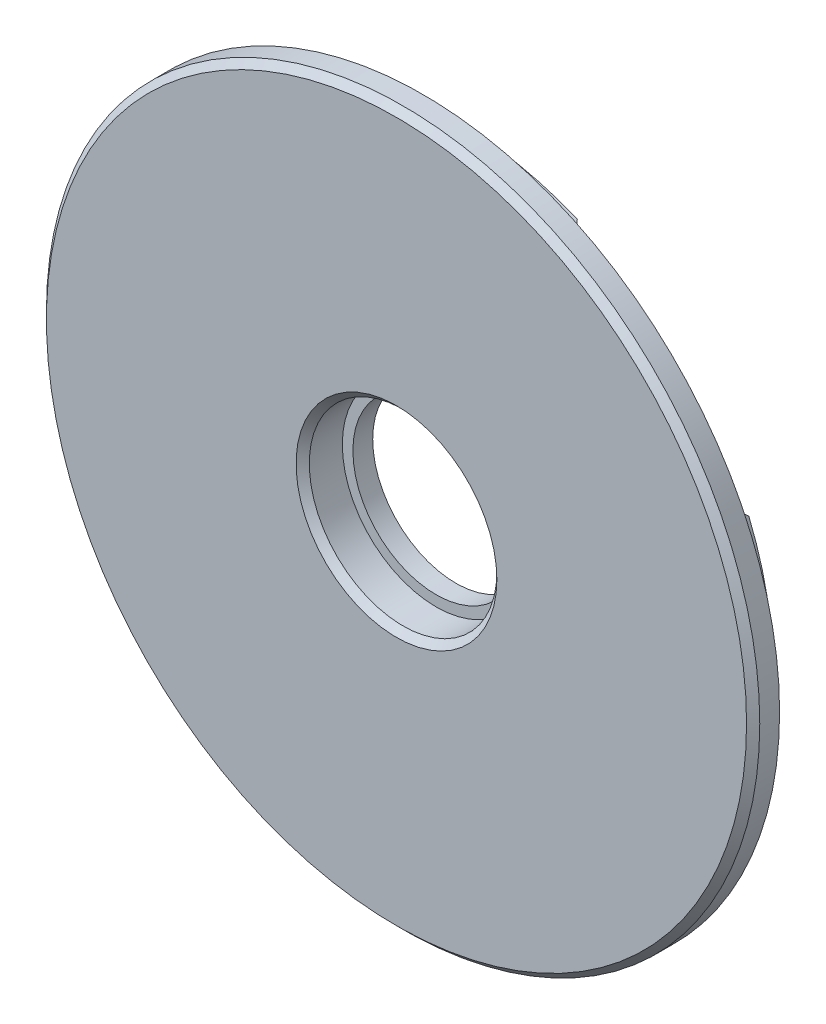
from build123d import *

# Parameters (mm, degrees)
SKETCH1_R                    = 24
SKETCH1_R_2                  = 22.8
BOSS_EXTRUDE1_DEPTH          = 2.5
BOSS_EXTRUDE5_START          = -2.5
BOSS_EXTRUDE5_DEPTH          = 1.5
CIRPATTERN1_COUNT            = 4
SKETCH2_R                    = 27
BOSS_EXTRUDE2_DEPTH          = 2
SKETCH3_R                    = 7.1
CUT_EXTRUDE1_DEPTH           = 39.448016854
SKETCH4_R                    = 8.3
SKETCH4_R_2                  = 7.1
BOSS_EXTRUDE3_DEPTH          = 2.5
BOSS_EXTRUDE4_START          = -1.5
SKETCH5_R                    = 8.3
SKETCH5_R_2                  = 6.3
BOSS_EXTRUDE4_DEPTH          = 1.5
CUT_EXTRUDE2_DEPTH           = 2.5
CHAMFER2_SIZE                = 2.5
CIRPATTERN2_COUNT            = 4
CHAMFER2_OF_CIRPATTERN2_SIZE = 2.5
FILLET1_R                    = 2
CHAMFER1_SIZE                = 0.5


# Some blends are built 0.0001 mm under size
with BuildPart() as part:
    # Sketch1 → Boss-Extrude1 (new body)
    with BuildSketch(Plane.XY):
        Circle(SKETCH1_R)
        Circle(SKETCH1_R_2, mode=Mode.SUBTRACT)
    extrude(amount=BOSS_EXTRUDE1_DEPTH)

    # Sketch6 → Boss-Extrude5 (add)
    with BuildSketch(Plane.XY.offset(2.5).offset(BOSS_EXTRUDE5_START)):
        with BuildLine():
            ThreePointArc((23.953079134, 1.5), (24, 0), (23.953079134, -1.5))
            ThreePointArc((23.953079134, -1.5), (24.3, 0), (23.953079134, 1.5))
        make_face()
    boss_extrude5 = extrude(amount=BOSS_EXTRUDE5_DEPTH)

    # CirPattern1: Boss-Extrude5 ×4 about axis
    cirpattern1_axis = Axis((0, 0, 0), (0, 0, 1))
    for i in range(1, CIRPATTERN1_COUNT):
        add(boss_extrude5.rotate(cirpattern1_axis, i * 360 / CIRPATTERN1_COUNT))

    # Sketch2 → Boss-Extrude2 (add)
    with BuildSketch(Plane.XY.offset(2.5)):
        Circle(SKETCH2_R)
    extrude(amount=BOSS_EXTRUDE2_DEPTH)

    # Sketch3 → Cut-Extrude1 (cut, through all)
    with BuildSketch(Plane.XY.offset(4.5)):
        Circle(SKETCH3_R)
    extrude(amount=-CUT_EXTRUDE1_DEPTH, mode=Mode.SUBTRACT)

    # Sketch4 → Boss-Extrude3 (add, through all)
    with BuildSketch(Plane(origin=(0, 0, 2.5), x_dir=(-1, 0, 0), z_dir=(0, 0, -1))):
        with Locations(Location((0, 0, 0), (0, 0, 180))):
            Circle(SKETCH4_R)
        with Locations(Location((0, 0, 0), (0, 0, 180))):
            Circle(SKETCH4_R_2, mode=Mode.SUBTRACT)
    extrude(amount=BOSS_EXTRUDE3_DEPTH)

    # Sketch5 → Boss-Extrude4 (add)
    with BuildSketch(Plane(origin=(0, 0, 0), x_dir=(-1, 0, 0), z_dir=(0, 0, -1)).offset(BOSS_EXTRUDE4_START)):
        with Locations(Location((0, 0, 0), (0, 0, 180))):
            Circle(SKETCH5_R)
        Circle(SKETCH5_R_2, mode=Mode.SUBTRACT)
    extrude(amount=BOSS_EXTRUDE4_DEPTH)

    # Sketch7 → Cut-Extrude2 (cut)
    with BuildSketch(Plane(origin=(0, 0, 0), x_dir=(-1, 0, 0), z_dir=(0, 0, -1))):
        with BuildLine():
            ThreePointArc((8.725182258, 21.064453341), (12.667001313, 18.95750716), (16.122034611, 16.122034611))
            Line((16.122034611, 16.122034611), (16.970562748, 16.970562748))
            ThreePointArc((16.970562748, 16.970562748), (13.333685592, 19.955270695), (9.184402377, 22.17310878))
            Line((9.184402377, 22.17310878), (8.725182258, 21.064453341))
        make_face()
        with BuildLine():
            Line((16.970562748, 16.970562748), (16.122034611, 16.122034611))
            ThreePointArc((16.122034611, 16.122034611), (18.95750716, 12.667001313), (21.064453341, 8.725182258))
            Line((21.064453341, 8.725182258), (22.17310878, 9.184402377))
            ThreePointArc((22.17310878, 9.184402377), (19.955270695, 13.333685592), (16.970562748, 16.970562748))
        make_face()
    cut_extrude2 = extrude(amount=-CUT_EXTRUDE2_DEPTH, mode=Mode.SUBTRACT)

    # Chamfer2
    chamfer2_edges = [part.edges().sort_by_distance(p)[0] for p in [
        (-21.618781061, 8.954792317, 2.5),
        (-8.954792317, 21.618781061, 2.5),
    ]]
    chamfer(chamfer2_edges, length=CHAMFER2_SIZE - 0.0001)  # a hair under: the kernel refuses the full size

    # CirPattern2: Cut-Extrude2 ×4 about axis
    cirpattern2_axis = Axis((0, 0, 0), (0, 0, 1))
    for i in range(1, CIRPATTERN2_COUNT):
        add(cut_extrude2.rotate(cirpattern2_axis, i * 360 / CIRPATTERN2_COUNT), mode=Mode.SUBTRACT)

    # Chamfer2 of CirPattern2
    chamfer2_of_cirpattern2_edges = [part.edges().sort_by_distance(p)[0] for p in [
        (-8.954792317, -21.618781061, 2.5),
        (-21.618781061, -8.954792317, 2.5),
        (21.618781061, -8.954792317, 2.5),
        (8.954792317, -21.618781061, 2.5),
        (8.954792317, 21.618781061, 2.5),
        (21.618781061, 8.954792317, 2.5),
    ]]
    chamfer(chamfer2_of_cirpattern2_edges, length=CHAMFER2_OF_CIRPATTERN2_SIZE - 0.0001)  # a hair under: the kernel refuses the full size

    # Fillet1
    # the kernel refuses this fillet: 2 mm, written as the material it adds along each edge
    with BuildSketch(Plane(origin=(0, 0, 2.5), x_dir=(1, 0, 0), z_dir=(0, 1, 0))) as fillet1_piece_1:
        with BuildLine():
            CenterArc((8.3 + FILLET1_R, FILLET1_R), FILLET1_R, 180, 90)
            Line((8.3, FILLET1_R), (8.3, 0))
            Line((8.3, 0), (8.3 + FILLET1_R, 0))
        make_face()
    revolve(axis=Axis((0, 0, 2.5), (0, 0, -1)))
    with BuildSketch(Plane(origin=(0, 0, 2.5), x_dir=(0.6608111736340745, -0.7505521919229581, 0), z_dir=(0.7505521919229581, 0.6608111736340745, 0))) as fillet1_piece_2_section:
        with BuildLine():
            CenterArc((22.8 - FILLET1_R, FILLET1_R), FILLET1_R, 270, 90)
            Line((22.8, FILLET1_R), (22.8, 0))
            Line((22.8, 0), (22.8 - FILLET1_R, 0))
        make_face()
    fillet1_piece_2 = revolve(axis=Axis((0, 0, 2.5), (0, 0, -1)), revolution_arc=82.723533759, mode=Mode.PRIVATE)
    fillet1_piece_2 = split(fillet1_piece_2, bisect_by=Plane(origin=(-4.823831946, -20.235955974, -3.287225486), z_dir=(0.653281482438186, -0.27059805007310406, 0.7071067811865476)), keep=Keep.TOP, mode=Mode.PRIVATE)
    fillet1_piece_2 = split(fillet1_piece_2, bisect_by=Plane(origin=(4.823831946, -20.235955974, -3.287225486), z_dir=(-0.6532814824381898, -0.2705980500730944, 0.7071067811865478)), keep=Keep.TOP, mode=Mode.PRIVATE)
    add(fillet1_piece_2)
    with BuildSketch(Plane(origin=(0, 0, 2.5), x_dir=(0.7505521919229583, 0.6608111736340745, 0), z_dir=(-0.6608111736340745, 0.7505521919229583, 0))) as fillet1_piece_3_section:
        with BuildLine():
            CenterArc((22.8 - FILLET1_R, FILLET1_R), FILLET1_R, 270, 90)
            Line((22.8, FILLET1_R), (22.8, 0))
            Line((22.8, 0), (22.8 - FILLET1_R, 0))
        make_face()
    fillet1_piece_3 = revolve(axis=Axis((0, 0, 2.5), (0, 0, -1)), revolution_arc=82.723533759, mode=Mode.PRIVATE)
    fillet1_piece_3 = split(fillet1_piece_3, bisect_by=Plane(origin=(20.235955974, -4.823831946, -3.287225486), z_dir=(0.2705980500731041, 0.6532814824381858, 0.7071067811865477)), keep=Keep.TOP, mode=Mode.PRIVATE)
    fillet1_piece_3 = split(fillet1_piece_3, bisect_by=Plane(origin=(20.235955974, 4.823831946, -3.287225486), z_dir=(0.27059805007309445, -0.6532814824381898, 0.7071067811865478)), keep=Keep.TOP, mode=Mode.PRIVATE)
    add(fillet1_piece_3)
    with BuildSketch(Plane(origin=(0, 0, 2.5), x_dir=(-0.750552191922958, -0.6608111736340746, 0), z_dir=(0.6608111736340746, -0.750552191922958, 0))) as fillet1_piece_4_section:
        with BuildLine():
            CenterArc((22.8 - FILLET1_R, FILLET1_R), FILLET1_R, 270, 90)
            Line((22.8, FILLET1_R), (22.8, 0))
            Line((22.8, 0), (22.8 - FILLET1_R, 0))
        make_face()
    fillet1_piece_4 = revolve(axis=Axis((0, 0, 2.5), (0, 0, -1)), revolution_arc=82.723533759, mode=Mode.PRIVATE)
    fillet1_piece_4 = split(fillet1_piece_4, bisect_by=Plane(origin=(-20.235955974, 4.823831946, -3.287225486), z_dir=(-0.2705980500731042, -0.6532814824381858, 0.7071067811865477)), keep=Keep.TOP, mode=Mode.PRIVATE)
    fillet1_piece_4 = split(fillet1_piece_4, bisect_by=Plane(origin=(-20.235955974, -4.823831946, -3.287225486), z_dir=(-0.2705980500730945, 0.6532814824381897, 0.7071067811865478)), keep=Keep.TOP, mode=Mode.PRIVATE)
    add(fillet1_piece_4)
    with BuildSketch(Plane(origin=(0, 0, 2.5), x_dir=(-0.6608111736340749, 0.7505521919229577, 0), z_dir=(-0.7505521919229577, -0.6608111736340749, 0))) as fillet1_piece_5_section:
        with BuildLine():
            CenterArc((22.8 - FILLET1_R, FILLET1_R), FILLET1_R, 270, 90)
            Line((22.8, FILLET1_R), (22.8, 0))
            Line((22.8, 0), (22.8 - FILLET1_R, 0))
        make_face()
    fillet1_piece_5 = revolve(axis=Axis((0, 0, 2.5), (0, 0, -1)), revolution_arc=82.723533759, mode=Mode.PRIVATE)
    fillet1_piece_5 = split(fillet1_piece_5, bisect_by=Plane(origin=(-4.823831946, 20.235955974, -3.287225486), z_dir=(0.6532814824381898, 0.2705980500730944, 0.7071067811865478)), keep=Keep.TOP, mode=Mode.PRIVATE)
    fillet1_piece_5 = split(fillet1_piece_5, bisect_by=Plane(origin=(4.823831946, 20.235955974, -3.287225486), z_dir=(-0.6532814824381858, 0.2705980500731041, 0.7071067811865477)), keep=Keep.TOP, mode=Mode.PRIVATE)
    add(fillet1_piece_5)

    # Chamfer1
    chamfer1_edges = [part.edges().sort_by_distance(p)[0] for p in [
        (-27, 0, 4.5),
        (-7.1, 0, 4.5),
    ]]
    chamfer(chamfer1_edges, length=CHAMFER1_SIZE)


solid = part.part
